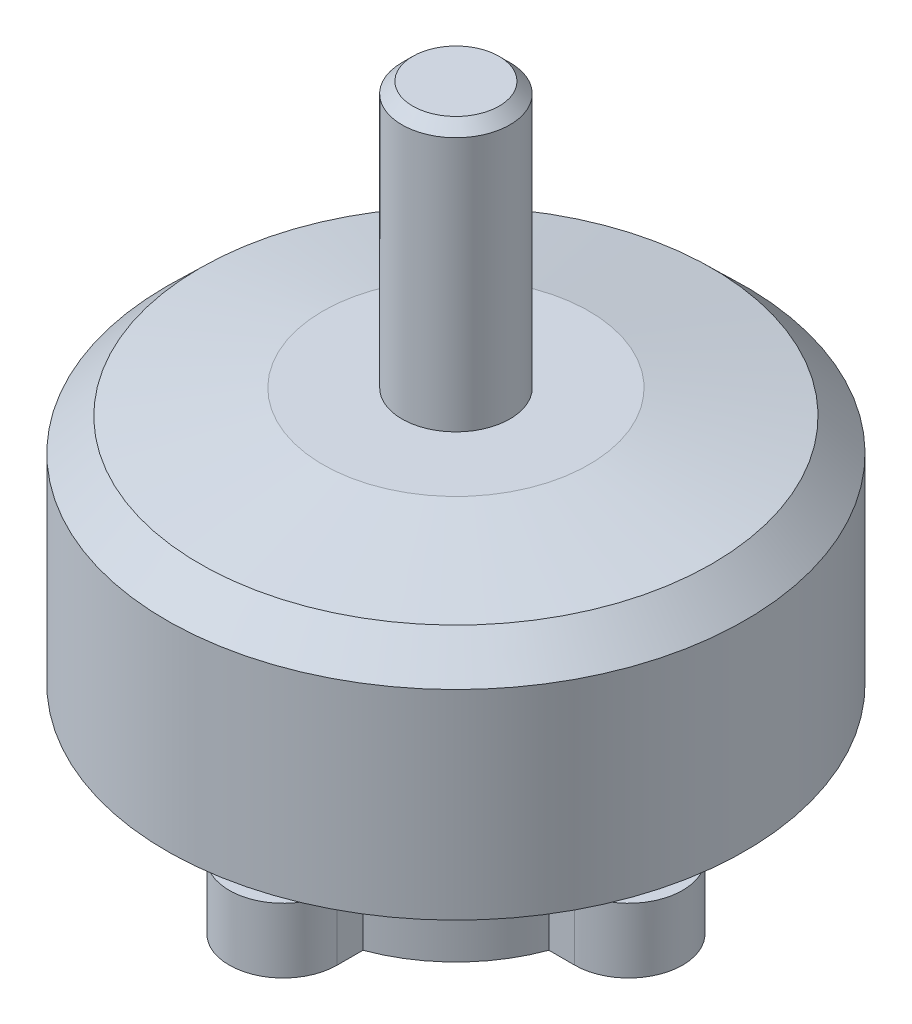
from build123d import *
from build123d.topology import SkipClean

# Parameters (mm, degrees)
SKETCH_1_R                      = 1.25
SKETCH_1_R_2                    = 6
EXTRUDE_1_DEPTH                 = 3
SKETCH_3_R                      = 1.25
CUT_EXTRUDE_1_DEPTH             = 16.516120649
EXTRUDE_2_DEPTH                 = 0.75
PATTERN_CIRCULAR_1_COPY_1_DEPTH = 0.75
PATTERN_CIRCULAR_1_COPY_2_DEPTH = 0.75
PATTERN_CIRCULAR_1_COPY_3_DEPTH = 0.75
PATTERN_CIRCULAR_1_COPY_4_DEPTH = 0.75
PATTERN_CIRCULAR_1_COPY_5_DEPTH = 0.75
PATTERN_CIRCULAR_1_COPY_6_DEPTH = 0.75
SKETCH_8_R                      = 2.5
EXTRUDE_3_DEPTH                 = 12.3
CHAMFER_2_SIZE                  = 0.5
CHAMFER_3_SIZE                  = 0.5


with BuildPart() as part:
    # Эскиз1 → Бобышка-Вытянуть1 (new body)
    with BuildSketch(Plane(origin=(0, 0, 0), x_dir=(1, 0, 0), z_dir=(0, 1, 0))):
        with BuildLine():
            Line((2.5, 6.805328794), (2.5, 8))
            ThreePointArc((2.5, 8), (0, 10.5), (-2.5, 8))
            Line((-2.5, 8), (-2.5, 6.805328794))
            ThreePointArc((-2.5, 6.805328794), (-5.126524164, 5.126524164), (-6.805328794, 2.5))
            Line((-6.805328794, 2.5), (-8, 2.5))
            ThreePointArc((-8, 2.5), (-10.5, 0), (-8, -2.5))
            Line((-8, -2.5), (-6.805328794, -2.5))
            ThreePointArc((-6.805328794, -2.5), (-5.126524164, -5.126524164), (-2.5, -6.805328794))
            Line((-2.5, -6.805328794), (-2.5, -8))
            ThreePointArc((-2.5, -8), (0, -10.5), (2.5, -8))
            Line((2.5, -8), (2.5, -6.805328794))
            ThreePointArc((2.5, -6.805328794), (5.126524164, -5.126524164), (6.805328794, -2.5))
            Line((6.805328794, -2.5), (8, -2.5))
            ThreePointArc((8, -2.5), (10.5, 0), (8, 2.5))
            Line((8, 2.5), (6.805328794, 2.5))
            ThreePointArc((6.805328794, 2.5), (5.126524164, 5.126524164), (2.5, 6.805328794))
        make_face()
        with Locations((0, 8)):
            Circle(SKETCH_1_R, mode=Mode.SUBTRACT)
        Circle(SKETCH_1_R_2, mode=Mode.SUBTRACT)
        with Locations((8, 0)):
            Circle(SKETCH_1_R, mode=Mode.SUBTRACT)
        with Locations((-8, 0)):
            Circle(SKETCH_1_R, mode=Mode.SUBTRACT)
        with Locations((0, -8)):
            Circle(SKETCH_1_R, mode=Mode.SUBTRACT)
    extrude(amount=EXTRUDE_1_DEPTH)

    # Эскиз2 → Повернуть1 (revolve)
    with BuildSketch(Plane(origin=(0, 0, 0), x_dir=(0, 0, -1), z_dir=(1, 0, 0))):
        Polygon((6, 3), (4.2, 4.5), (0, 4.5), (0, 5.5), (3.805328794, 5.5), (6.805328794, 3), align=None)
    revolve(axis=Axis((0, 4.5, 0), (0, 1, 0)))

    # Эскиз3 → Вырез-Вытянуть1 (cut, through all)
    with BuildSketch(Plane.XZ.offset(-4.5)):
        Circle(SKETCH_3_R)
    extrude(amount=-CUT_EXTRUDE_1_DEPTH, mode=Mode.SUBTRACT)

    # Эскиз4 → Бобышка-Вытянуть2 (add)
    with SkipClean():  # the faces are left unmerged after this step: merging them gives an invalid solid
        with BuildSketch(Plane.XY.offset(2.5)):
            Polygon((8.0234375, 3), (2.868889547, 5.5), (6.329494451, 3), (6.805328794, 3), align=None)
        extrude_2 = extrude(amount=-EXTRUDE_2_DEPTH)

    # Зеркальное отражение1: Бобышка-Вытянуть2 across plane
    add(extrude_2.mirror(Plane.XY))

    # Круговой массив1 copy 1 sketch → Круговой массив1 copy 1 (add)
    with BuildSketch(Plane(origin=(2.5, 0, 0), x_dir=(0, 0, 1), z_dir=(1, 0, 0))):
        Polygon((8.0234375, -3), (2.868889547, -5.5), (6.329494451, -3), (6.805328794, -3), align=None)
    extrude(amount=-PATTERN_CIRCULAR_1_COPY_1_DEPTH)

    # Круговой массив1 copy 2 sketch → Круговой массив1 copy 2 (add)
    with BuildSketch(Plane(origin=(0, 0, 2.5), x_dir=(-1, 0, 0), z_dir=(0, 0, 1))):
        Polygon((8.0234375, -3), (2.868889547, -5.5), (6.329494451, -3), (6.805328794, -3), align=None)
    extrude(amount=-PATTERN_CIRCULAR_1_COPY_2_DEPTH)

    # Круговой массив1 copy 3 sketch → Круговой массив1 copy 3 (add)
    with BuildSketch(Plane(origin=(-2.5, 0, 0), x_dir=(0, 0, -1), z_dir=(-1, 0, 0))):
        Polygon((8.0234375, -3), (2.868889547, -5.5), (6.329494451, -3), (6.805328794, -3), align=None)
    extrude(amount=-PATTERN_CIRCULAR_1_COPY_3_DEPTH)

    # Круговой массив1 copy 4 sketch → Круговой массив1 copy 4 (add)
    with BuildSketch(Plane.ZY.offset(2.5)):
        Polygon((8.0234375, 3), (2.868889547, 5.5), (6.329494451, 3), (6.805328794, 3), align=None)
    extrude(amount=-PATTERN_CIRCULAR_1_COPY_4_DEPTH)

    # Круговой массив1 copy 5 sketch → Круговой массив1 copy 5 (add)
    with BuildSketch(Plane(origin=(0, 0, -2.5), x_dir=(-1, 0, 0), z_dir=(0, 0, -1))):
        Polygon((8.0234375, 3), (2.868889547, 5.5), (6.329494451, 3), (6.805328794, 3), align=None)
    extrude(amount=-PATTERN_CIRCULAR_1_COPY_5_DEPTH)

    # Круговой массив1 copy 6 sketch → Круговой массив1 copy 6 (add)
    with BuildSketch(Plane(origin=(2.5, 0, 0), x_dir=(0, 0, -1), z_dir=(1, 0, 0))):
        Polygon((8.0234375, 3), (2.868889547, 5.5), (6.329494451, 3), (6.805328794, 3), align=None)
    extrude(amount=-PATTERN_CIRCULAR_1_COPY_6_DEPTH)

    # Эскиз7 → Повернуть3 (revolve)
    with BuildSketch(Plane.XY):
        Polygon((5.363228728, 4.290224088), (5.363228728, 6.03046627), (13.4, 6.03046627), (13.4, 15.28046627), (11.86181019, 16.777751396), (6.16327969, 17.907637033), (0, 17.907637033), (0, 4.290224088), align=None)
    revolve(axis=Axis((0, 17.907637033, 0), (0, -1, 0)))

    # Эскиз8 → Бобышка-Вытянуть3 (add)
    with BuildSketch(Plane(origin=(0, 17.907637033, 0), x_dir=(1, 0, 0), z_dir=(0, 1, 0))):
        Circle(SKETCH_8_R)
    extrude(amount=EXTRUDE_3_DEPTH)

    # Фаска2
    chamfer_2_edges = [part.edges().sort_by_distance(p)[0] for p in [
        (-2.5, 30.207637033, 0),
    ]]
    chamfer(chamfer_2_edges, length=CHAMFER_2_SIZE)

    # Фаска3
    chamfer_3_edges = [part.edges().sort_by_distance(p)[0] for p in [
        (-1.25, 0, -8),
        (6.75, 0, 0),
        (-1.25, 0, 8),
        (-9.25, 0, 0),
    ]]
    chamfer(chamfer_3_edges, length=CHAMFER_3_SIZE)


solid = part.part
